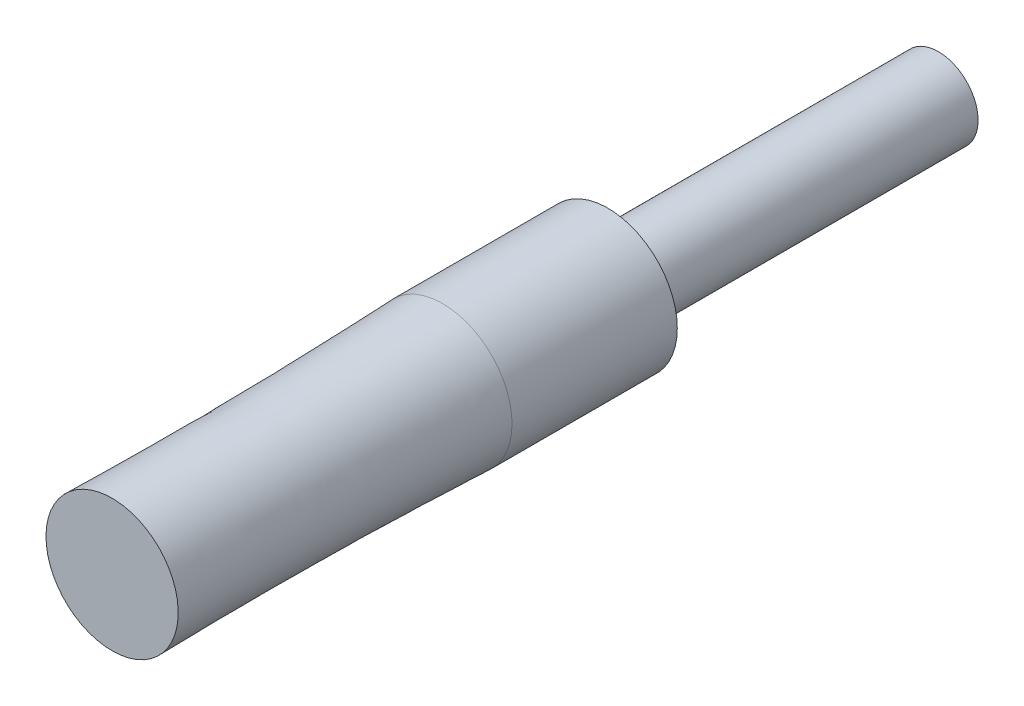
from build123d import *

# Parameters (mm, degrees)
ESBO_O1_R                = 4.2
RESSALTO_EXTRUS_O1_DEPTH = 10
ESBO_O3_R                = 2.4
RESSALTO_EXTRUS_O2_DEPTH = 20


with BuildPart() as part:
    # Esboço1 → Ressalto-extrusão1 (new body)
    with BuildSketch(Plane.XY):
        Circle(ESBO_O1_R)
    extrude(amount=RESSALTO_EXTRUS_O1_DEPTH)

    # Loft1: read off the stored shape, not the designer's step
    # Loft1: loft between two sections, ruled curve by curve
    loft1_from = [
        Edge.make_bspline([(1.94680537, -3.494273723, 30), (-5.041742075, -7.387884464, 30), (-8.935352816, -0.399337018, 30), (-1.94680537, 3.494273723, 30), (5.041742075, 7.387884464, 30), (8.935352816, 0.399337018, 30), (1.94680537, -3.494273723, 30)], [0, 0, 0, 0, 0.5, 0.5, 0.5, 1, 1, 1, 1], 3, [1, 0.333333333, 0.333333333, 1, 0.333333333, 0.333333333, 1]),
    ]
    loft1_to = [
        Edge.make_bspline([(-0.110822525, -4.198537646, 10), (-8.507897818, -3.976892596, 10), (-8.286252768, 4.420182696, 10), (0.110822525, 4.198537646, 10), (8.507897818, 3.976892596, 10), (8.286252768, -4.420182696, 10), (-0.110822525, -4.198537646, 10)], [0, 0, 0, 0, 0.5, 0.5, 0.5, 1, 1, 1, 1], 3, [1, 0.333333333, 0.333333333, 1, 0.333333333, 0.333333333, 1]),
    ]
    loft1 = Solid(Shell([*[Face.make_surface_from_curves(loft1_from[k], loft1_to[k]) for k in range(1)], Face(Wire(loft1_from)), Face(Wire(loft1_to))]))
    add(loft1)

    # Esboço3 → Ressalto-extrusão2 (add)
    with BuildSketch(Plane(origin=(0, 0, 0), x_dir=(-1, 0, 0), z_dir=(0, 0, -1))):
        Circle(ESBO_O3_R)
    extrude(amount=RESSALTO_EXTRUS_O2_DEPTH)


solid = part.part
